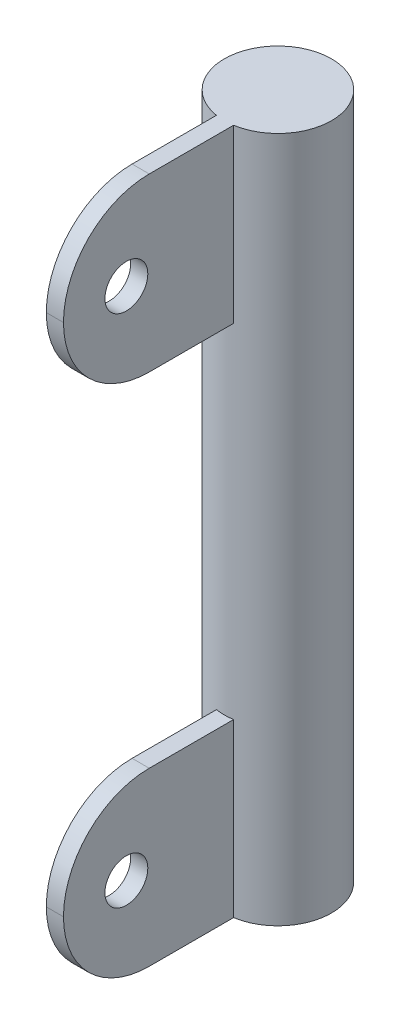
from build123d import *

# Parameters (mm, degrees)
SKETCH1_R            = 12.5
BOSS_EXTRUDE1_DEPTH  = 160
SKETCH2_W            = 4
SKETCH2_H            = 40
BOSS_EXTRUDE2_DEPTH  = 40
FILLET1_R            = 20
SKETCH3_R            = 5
CUT_EXTRUDE1_DEPTH   = 169.861629745
FILLET1_OF_MIRROR2_R = 20


with BuildPart() as part:
    # Sketch1 → Boss-Extrude1 (new body)
    with BuildSketch(Plane(origin=(0, 0, 0), x_dir=(1, 0, 0), z_dir=(0, 1, 0))):
        with Locations(Location((0, 0, 0), (0, 0, 270))):
            Circle(SKETCH1_R)
    extrude(amount=BOSS_EXTRUDE1_DEPTH)

    # Sketch2 → Boss-Extrude2 (add)
    with BuildSketch(Plane.XY.offset(12)):
        with Locations((0, 140)):
            Rectangle(SKETCH2_W, SKETCH2_H)
    boss_extrude2 = extrude(amount=BOSS_EXTRUDE2_DEPTH)

    # Fillet1
    fillet1_edges = [part.edges().sort_by_distance(p)[0] for p in [
        (0, 120, 52),
        (0, 160, 52),
    ]]
    fillet(fillet1_edges, radius=FILLET1_R - 0.0001)  # a hair under: the kernel refuses the full size

    # Sketch3 → Cut-Extrude1 (cut, through all)
    with BuildSketch(Plane(origin=(2, 0, 0), x_dir=(0, 0, -1), z_dir=(1, 0, 0))):
        with Locations(Location((-37.338962679, 140, 0), (0, 0, 90))):
            Circle(SKETCH3_R)
    cut_extrude1 = extrude(amount=-CUT_EXTRUDE1_DEPTH, mode=Mode.SUBTRACT)

    # Mirror2: Boss-Extrude2, Cut-Extrude1 across plane
    add(boss_extrude2.mirror(Plane.ZX.offset(80)))
    add(cut_extrude1.mirror(Plane.ZX.offset(80)), mode=Mode.SUBTRACT)

    # Fillet1 of Mirror2
    fillet1_of_mirror2_edges = [part.edges().sort_by_distance(p)[0] for p in [
        (0, 40, 52),
        (0, 0, 52),
    ]]
    fillet(fillet1_of_mirror2_edges, radius=FILLET1_OF_MIRROR2_R - 0.0001)  # a hair under: the kernel refuses the full size


solid = part.part
